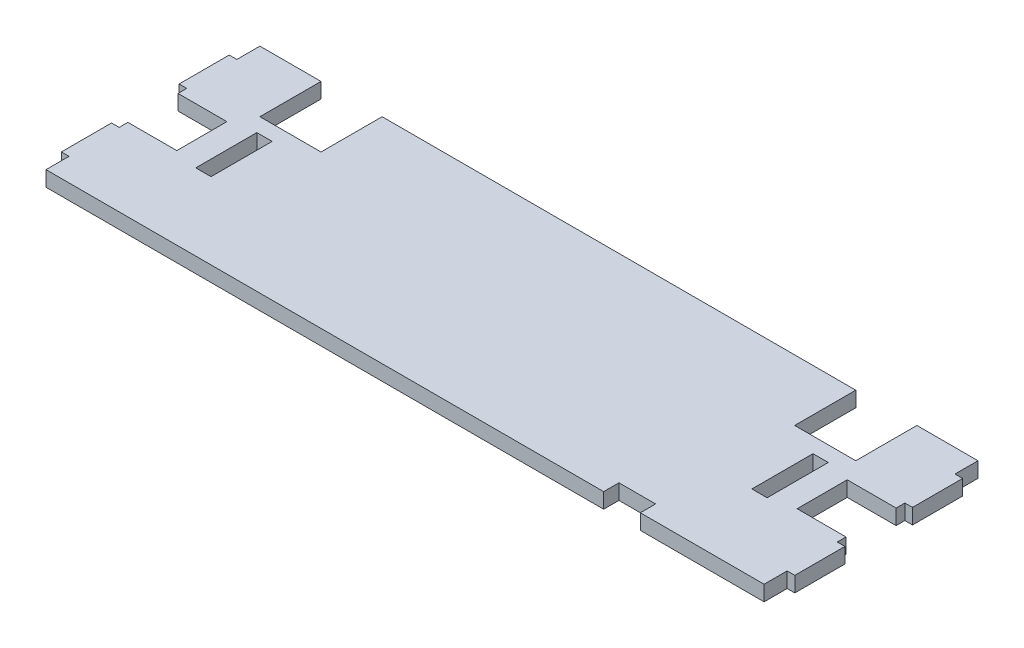
from build123d import *

# Parameters (mm, degrees)
BOSS_EXTRUDE1_DEPTH     = 3.175
CUT_EXTRUDE1_DEPTH      = 159.781746826
CUT_EXTRUDE1_DEPTH_BACK = 159.781746826
SKETCH2_W               = 6.35
SKETCH2_H               = 25.4


with BuildPart() as part:
    # Sketch1 → Boss-Extrude1 (new, symmetric)
    with BuildSketch(Plane(origin=(0, 0, 0), x_dir=(1, 0, 0), z_dir=(0, 1, 0))):
        Polygon((149.225, -44.45), (97.79, -44.45), (97.79, -38.1), (82.55, -38.1), (82.55, -44.45), (-149.225, -44.45), (-149.225, -34.874677354), (-152.4, -34.874677354), (-152.4, -14.046677354), (-149.225, -14.046677354), (-149.225, -10.414), (-128.905, -10.414), (-128.905, 10.414), (-149.225, 10.414), (-149.225, 14.046677354), (-152.4, 14.046677354), (-152.4, 34.874677354), (-149.225, 34.874677354), (-149.225, 44.45), (-123.825, 44.45), (-123.825, 19.05), (-98.425, 19.05), (-98.425, 44.45), (98.425, 44.45), (98.425, 19.05), (123.825, 19.05), (123.825, 44.45), (149.225, 44.45), (149.225, 34.874677354), (152.4, 34.874677354), (152.4, 14.046677354), (149.225, 14.046677354), (149.225, 10.414), (128.905, 10.414), (128.905, -10.414), (149.225, -10.414), (149.225, -14.046677354), (152.4, -14.046677354), (152.4, -34.874677354), (149.225, -34.874677354), align=None)
    extrude(amount=BOSS_EXTRUDE1_DEPTH, both=True)

    # Sketch2 → Cut-Extrude1 (cut, two sides: drawn at the far end of the back side and taken through both)
    with BuildSketch(Plane(origin=(0, 0, 0), x_dir=(1, 0, 0), z_dir=(0, 1, 0)).offset(-CUT_EXTRUDE1_DEPTH_BACK)):
        with Locations((115.57, 0)):
            Rectangle(SKETCH2_W, SKETCH2_H)
        with Locations((-115.57, 0)):
            Rectangle(SKETCH2_W, SKETCH2_H)
    extrude(amount=CUT_EXTRUDE1_DEPTH + CUT_EXTRUDE1_DEPTH_BACK, mode=Mode.SUBTRACT)


solid = part.part
